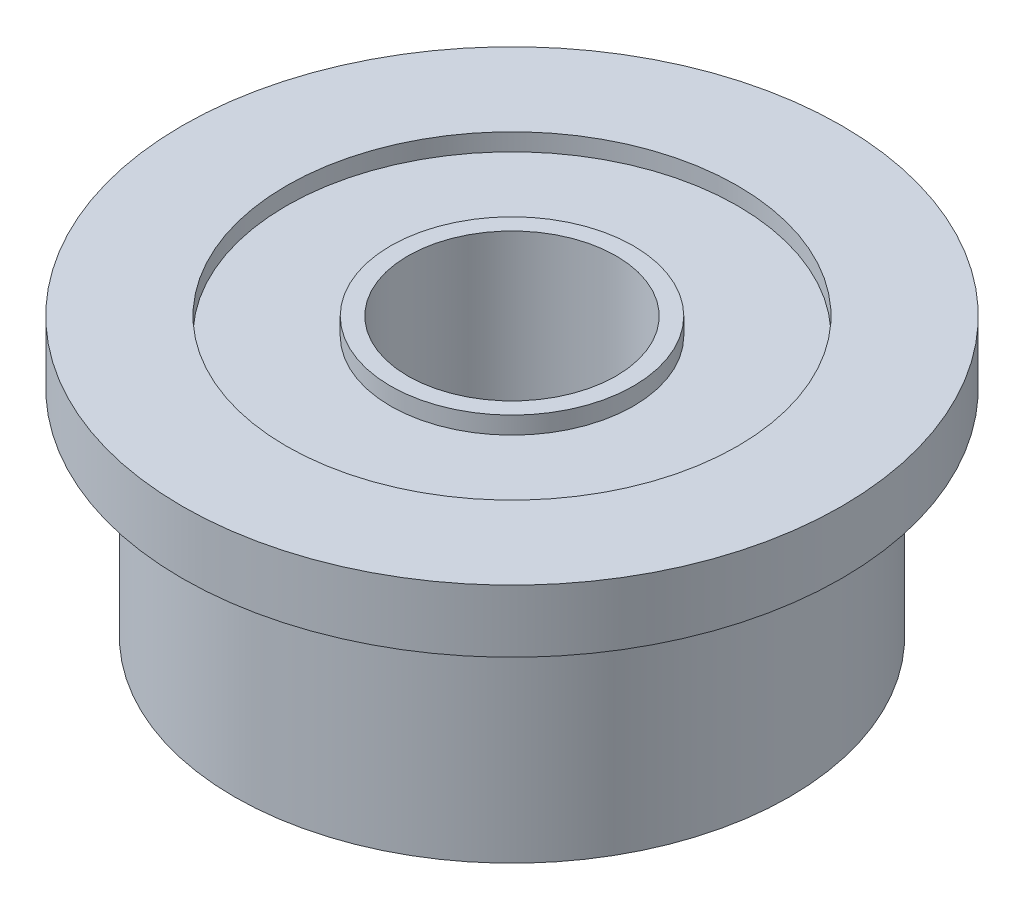
from build123d import *

# Parameters (mm, degrees)
SKETCH1_R           = 4
SKETCH1_R_2         = 1.5
BOSS_EXTRUDE1_DEPTH = 4
SKETCH2_R           = 3.25
SKETCH2_R_2         = 1.75
CUT_EXTRUDE1_DEPTH  = 0.25
BOSS_EXTRUDE2_START = -0.9
SKETCH3_R           = 4.75
SKETCH3_R_2         = 4
BOSS_EXTRUDE2_DEPTH = 0.9


with BuildPart() as part:
    # Sketch1 → Boss-Extrude1 (new body)
    with BuildSketch(Plane(origin=(0, 0, 0), x_dir=(1, 0, 0), z_dir=(0, 1, 0))):
        Circle(SKETCH1_R)
        Circle(SKETCH1_R_2, mode=Mode.SUBTRACT)
    extrude(amount=BOSS_EXTRUDE1_DEPTH)

    # Sketch2 → Cut-Extrude1 (cut)
    with BuildSketch(Plane(origin=(0, 4, 0), x_dir=(1, 0, 0), z_dir=(0, 1, 0))):
        Circle(SKETCH2_R)
        Circle(SKETCH2_R_2, mode=Mode.SUBTRACT)
    cut_extrude1 = extrude(amount=-CUT_EXTRUDE1_DEPTH, mode=Mode.SUBTRACT)

    # Mirror1: Cut-Extrude1 across plane
    add(cut_extrude1.mirror(Plane.ZX.offset(2)), mode=Mode.SUBTRACT)

    # Sketch3 → Boss-Extrude2 (add)
    with BuildSketch(Plane(origin=(0, 4, 0), x_dir=(1, 0, 0), z_dir=(0, 1, 0)).offset(BOSS_EXTRUDE2_START)):
        Circle(SKETCH3_R)
        Circle(SKETCH3_R_2, mode=Mode.SUBTRACT)
    extrude(amount=BOSS_EXTRUDE2_DEPTH)


solid = part.part
